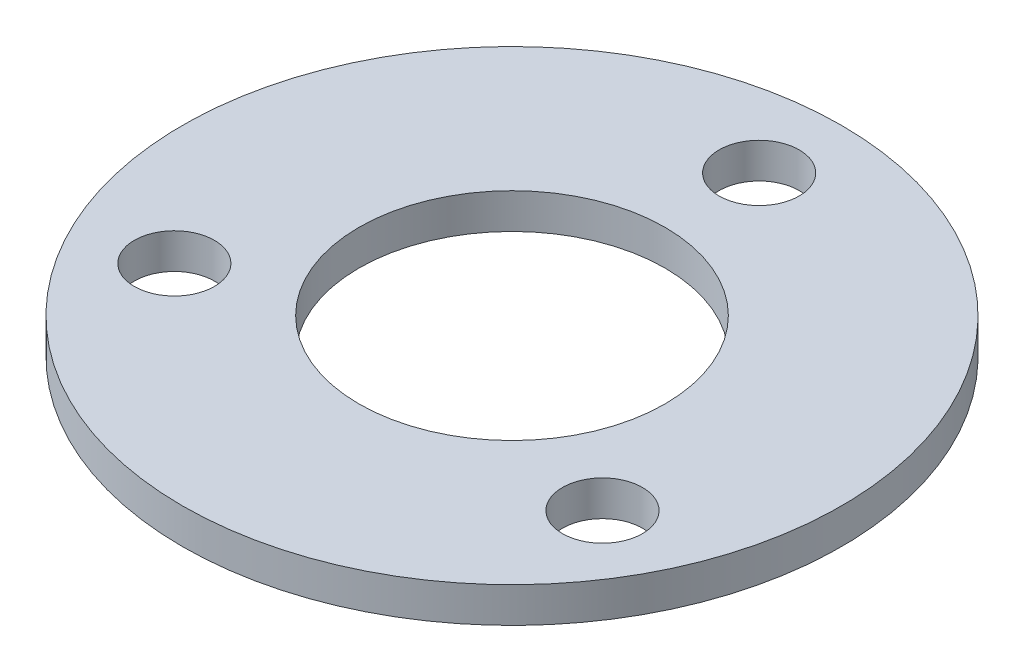
from build123d import *

# Parameters (mm, degrees)
SKETCH1_R           = 14
SKETCH1_R_2         = 6.5
SKETCH1_R_3         = 1.7
BOSS_EXTRUDE1_DEPTH = 1.5


with BuildPart() as part:
    # Sketch1 → Boss-Extrude1 (new body)
    with BuildSketch(Plane(origin=(0, 0, 0), x_dir=(1, 0, 0), z_dir=(0, 1, 0))):
        Circle(SKETCH1_R)
        Circle(SKETCH1_R_2, mode=Mode.SUBTRACT)
        with Locations((0, 10.5)):
            Circle(SKETCH1_R_3, mode=Mode.SUBTRACT)
        with Locations((9.09326674, -5.25)):
            Circle(SKETCH1_R_3, mode=Mode.SUBTRACT)
        with Locations((-9.09326674, -5.25)):
            Circle(SKETCH1_R_3, mode=Mode.SUBTRACT)
    extrude(amount=BOSS_EXTRUDE1_DEPTH)


solid = part.part
